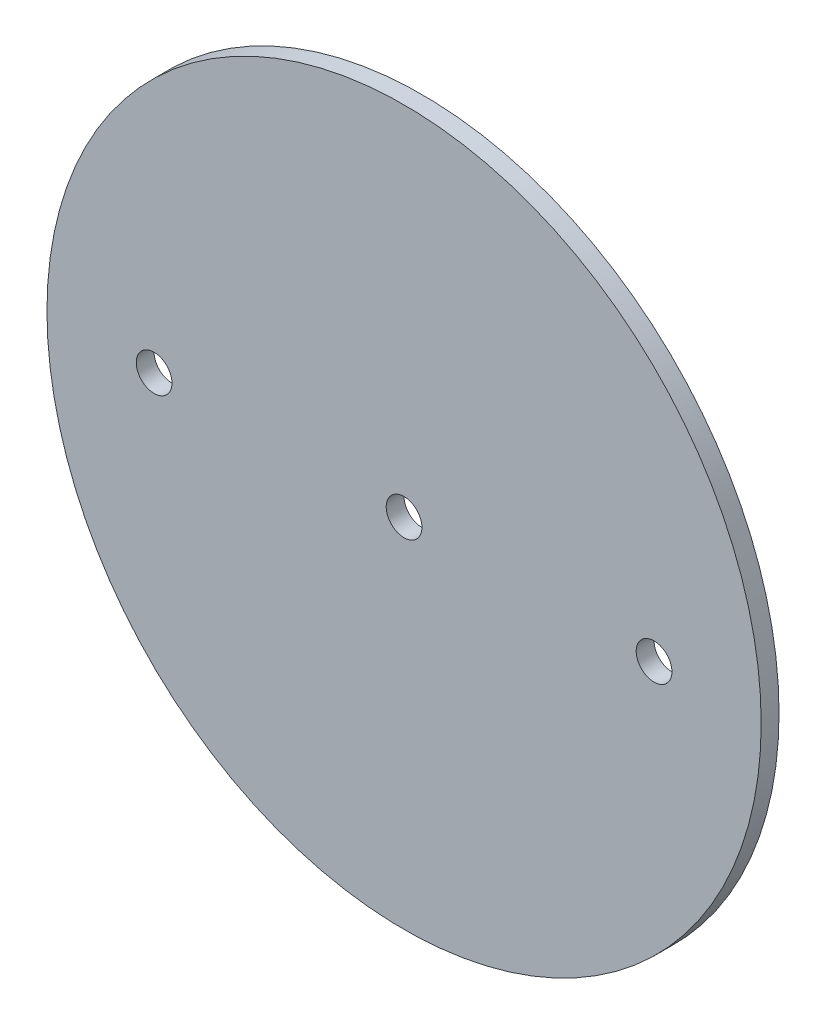
from build123d import *

# Parameters (mm, degrees)
SKETCH1_R                   = 63.5
BOSS_EXTRUDE1_DEPTH         = 1.5875
F_1_4_0_25_DIAMETER_HOLE1_D = 6.35


with BuildPart() as part:
    # Sketch1 → Boss-Extrude1 (new, symmetric)
    with BuildSketch(Plane.XY):
        Circle(SKETCH1_R)
    extrude(amount=BOSS_EXTRUDE1_DEPTH, both=True)

    # 1/4 (0.25) Diameter Hole1 (through all)
    with Locations(Plane.XY.offset(1.5875)):
        with Locations((-44.45, 0), (0, 0), (44.45, 0)):
            Hole(F_1_4_0_25_DIAMETER_HOLE1_D / 2)


solid = part.part
